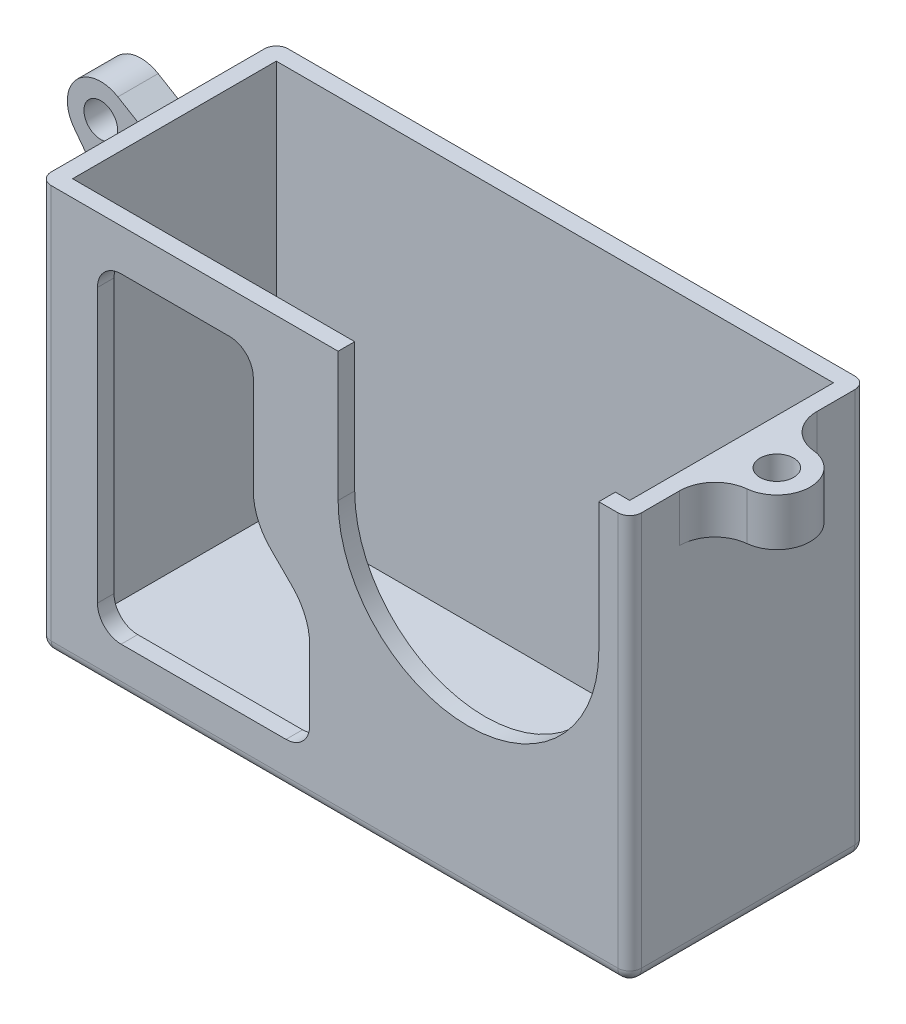
from build123d import *

# Parameters (mm, degrees)
SKETCH3_W               = 1.778
SKETCH3_H               = 21.844
SKETCH4_W               = 63.2968
SKETCH4_H               = 43.561
BOSS_EXTRUDE1_DEPTH     = 1.778
BOSS_EXTRUDE2_DEPTH     = 1.778
SKETCH6_R               = 1.8034
BOSS_EXTRUDE3_DEPTH     = 5.08
FILLET2_R               = 3.81
SKETCH7_R               = 1.8034
BOSS_EXTRUDE4_DEPTH     = 25.4
CUT_EXTRUDE1_DEPTH      = 82.893164904
CUT_EXTRUDE1_DEPTH_BACK = 82.893164904
SKETCH8_W               = 7.5438
SKETCH8_H               = 10.541
SKETCH13_R              = 2.52476
BOSS_EXTRUDE5_DEPTH     = 63.2968
SKETCH14_W              = 27.40279
SKETCH14_H              = 7.62
SKETCH14_H_2            = 8.382
SKETCH14_W_2            = 3.45694
CUT_EXTRUDE2_DEPTH      = 80.858589657
FILLET3_R               = 8.382
FILLET4_R               = 1.27


# Some blends are built 0.0001 mm under size
with BuildPart() as part:
    # Sweep1: sweep along a path in Sketch1
    with BuildLine(Plane.XY) as sweep1_path:
        Line((0, 41.783), (0, 0))
        Line((0, 0), (59.7408, 0))
        Line((59.7408, 0), (59.7408, 41.783))
    # Sketch3 → Sweep1 (sweep)
    with BuildSketch(Plane(origin=(0, 41.783, 0), x_dir=(1, 0, 0), z_dir=(0, 1, 0))):
        with Locations((-0.889, 0)):
            Rectangle(SKETCH3_W, SKETCH3_H)
    sweep(path=sweep1_path.line, transition=Transition.RIGHT)

    # Sketch4 → Boss-Extrude1 (add)
    with BuildSketch(Plane(origin=(0, 0, -10.922), x_dir=(-1, 0, 0), z_dir=(0, 0, -1))):
        with Locations((-29.8704, 20.0025)):
            Rectangle(SKETCH4_W, SKETCH4_H)
    extrude(amount=BOSS_EXTRUDE1_DEPTH)

    # Sketch5 → Boss-Extrude2 (add)
    # profile 1 of 2: a face of its own
    with BuildSketch(Plane.XY.offset(10.922)):
        with BuildLine():
            Line((30.2514, 41.783), (0, 41.783))
            Line((0, 41.783), (0, 0))
            Line((0, 0), (59.7408, 0))
            Line((59.7408, 0), (59.7408, 41.783))
            Line((59.7408, 41.783), (58.20156, 41.783))
            Line((58.20156, 41.783), (58.20156, 27.91968))
            ThreePointArc((58.20156, 27.91968), (44.22648, 13.9446), (30.2514, 27.91968))
            Line((30.2514, 27.91968), (30.2514, 41.783))
        make_face()
        with BuildLine():
            Line((4.445, 5.4864), (4.445, 34.798))
            ThreePointArc((4.445, 34.798), (5.188948776, 36.594051224), (6.985, 37.338))
            Line((6.985, 37.338), (18.6182, 37.338))
            ThreePointArc((18.6182, 37.338), (20.414251224, 36.594051224), (21.1582, 34.798))
            Line((21.1582, 34.798), (21.1582, 24.296354404))
            ThreePointArc((21.1582, 24.296354404), (21.641564969, 21.866314608), (23.018071939, 19.806226343))
            Line((23.018071939, 19.806226343), (25.343528061, 17.480770222))
            ThreePointArc((25.343528061, 17.480770222), (26.720035031, 15.420681957), (27.2034, 12.990642162))
            Line((27.2034, 12.990642162), (27.2034, 5.4864))
            ThreePointArc((27.2034, 5.4864), (26.459451224, 3.690348776), (24.6634, 2.9464))
            Line((24.6634, 2.9464), (6.985, 2.9464))
            ThreePointArc((6.985, 2.9464), (5.188948776, 3.690348776), (4.445, 5.4864))
        make_face(mode=Mode.SUBTRACT)
    # profile 2 of 2: a face of its own
    with BuildSketch(Plane.XY.offset(10.922)):
        Polygon((61.5188, 41.783), (59.7408, 41.783), (59.7408, 0), (0, 0), (0, 41.783), (-1.778, 41.783), (-1.778, -1.778), (61.5188, -1.778), align=None)
    extrude(amount=BOSS_EXTRUDE2_DEPTH)

    # Sketch6 → Boss-Extrude3 (add)
    with BuildSketch(Plane(origin=(0, 41.783, 0), x_dir=(1, 0, 0), z_dir=(0, 1, 0))):
        with BuildLine():
            Line((64.5922, 3.5814), (61.5188, 3.5814))
            Line((61.5188, 3.5814), (61.5188, -3.5814))
            Line((61.5188, -3.5814), (64.5922, -3.5814))
            ThreePointArc((64.5922, -3.5814), (68.1736, 0), (64.5922, 3.5814))
        make_face()
        with Locations(Location((64.5922, 0, 0), (0, 0, 180))):
            Circle(SKETCH6_R, mode=Mode.SUBTRACT)
    extrude(amount=-BOSS_EXTRUDE3_DEPTH)

    # Fillet2
    # the kernel refuses this fillet: 3.81 mm, written as the material it adds along each edge
    with BuildSketch(Plane(origin=(61.5188, 41.783, -3.5814), x_dir=(0, 0, -1), z_dir=(0, -1, 0))) as fillet2_piece_1:
        with BuildLine():
            CenterArc((3.773204979, 3.81), FILLET2_R, 185.719382358, 84.280617642)
            Line((-0.017828515, 3.430309278), (-0.396931865, 3.392340206))
            ThreePointArc((-0.396931865, 3.392340206), (-0.381, 3.0734), (-0.381, 0))
            Line((-0.381, 0), (0, -0.381))
            Line((0, -0.381), (3.773204979, -0.381))
            Line((3.773204979, -0.381), (3.773204979, 0))
        make_face()
    extrude(amount=5.08)
    with BuildSketch(Plane(origin=(61.5188, 41.783, 3.5814), x_dir=(0, 0, 1), z_dir=(0, -1, 0))) as fillet2_piece_2:
        with BuildLine():
            CenterArc((3.773204979, -3.81), FILLET2_R, 90, 84.280617642)
            Line((-0.017828515, -3.430309278), (-0.396931865, -3.392340206))
            ThreePointArc((-0.396931865, -3.392340206), (-0.381, -3.0734), (-0.381, 0))
            Line((-0.381, 0), (0, 0.381))
            Line((0, 0.381), (3.773204979, 0.381))
            Line((3.773204979, 0.381), (3.773204979, 0))
        make_face()
    extrude(amount=5.08)

    # Sketch7 → Boss-Extrude4 (add)
    with BuildSketch(Plane.XY.offset(12.7)):
        with BuildLine():
            Line((-1.778, 36.3982), (-1.778, 41.783))
            Line((-1.778, 41.783), (-3.902308892, 43.053335031))
            ThreePointArc((-3.902308892, 43.053335031), (-8.404920605, 42.372664125), (-8.599730754, 37.82306259))
            Line((-8.599730754, 37.82306259), (-1.778, 28.7782))
            Line((-1.778, 28.7782), (-1.778, 36.3982))
        make_face()
        with Locations((-5.7404, 39.9796)):
            Circle(SKETCH7_R, mode=Mode.SUBTRACT)
    extrude(amount=-BOSS_EXTRUDE4_DEPTH)

    # Sketch8 → Cut-Extrude1 (cut, two sides: drawn at the far end of the back side and taken through both)
    with BuildSketch(Plane(origin=(0, 41.783, 0), x_dir=(1, 0, 0), z_dir=(0, 1, 0)).offset(-CUT_EXTRUDE1_DEPTH_BACK)):
        with Locations((-5.5499, 7.4295)):
            Rectangle(SKETCH8_W, SKETCH8_H)
        with Locations((-5.5499, -7.4295)):
            Rectangle(SKETCH8_W, SKETCH8_H)
    extrude(amount=CUT_EXTRUDE1_DEPTH + CUT_EXTRUDE1_DEPTH_BACK, mode=Mode.SUBTRACT)

    # Sketch13 → Boss-Extrude5 (add)
    with BuildSketch(Plane.ZY.offset(1.778)):
        with BuildLine():
            Line((-21.082, -1.778), (-12.7, -1.778))
            Line((-12.7, -1.778), (-12.7, 13.462))
            Line((-12.7, 13.462), (-21.082, 13.462))
            ThreePointArc((-21.082, 13.462), (-28.702, 5.842), (-21.082, -1.778))
        make_face()
        with Locations((-21.082, 5.842)):
            Circle(SKETCH13_R, mode=Mode.SUBTRACT)
    extrude(amount=-BOSS_EXTRUDE5_DEPTH)

    # Sketch14 → Cut-Extrude2 (cut, through all)
    with BuildSketch(Plane(origin=(0, 13.462, 0), x_dir=(1, 0, 0), z_dir=(0, 1, 0))):
        with Locations((11.923395, 24.892)):
            Rectangle(SKETCH14_W, SKETCH14_H)
        with Locations((11.923395, 16.891)):
            Rectangle(SKETCH14_W, SKETCH14_H_2)
        with Locations((47.817405, 16.891)):
            Rectangle(SKETCH14_W, SKETCH14_H_2)
        with Locations((47.817405, 24.892)):
            Rectangle(SKETCH14_W, SKETCH14_H)
        with Locations((29.8704, 24.892)):
            Rectangle(SKETCH14_W_2, SKETCH14_H)
        with Locations((29.8704, 16.891)):
            Rectangle(SKETCH14_W_2, SKETCH14_H_2)
    extrude(amount=-CUT_EXTRUDE2_DEPTH, mode=Mode.SUBTRACT)

    # Fillet3
    fillet3_edges = [part.edges().sort_by_distance(p)[0] for p in [
        (26.88336, 13.462, -12.7),
        (32.85744, 13.462, -12.7),
    ]]
    fillet(fillet3_edges, radius=FILLET3_R - 0.0001)  # a hair under: the kernel refuses the full size

    # Fillet4
    fillet4_edges = [part.edges().sort_by_distance(p)[0] for p in [
        (61.5188, -1.778, 0),
        (-1.778, 20.0025, 12.7),
        (-1.778, -1.778, 0),
        (-1.778, 20.0025, -12.7),
        (11.923395, -1.778, -12.7),
        (47.817405, -1.778, -12.7),
        (29.8704, -1.778, -12.7),
        (61.5188, 20.0025, -12.7),
        (29.8704, -1.778, 12.7),
        (61.5188, 20.0025, 12.7),
    ]]
    fillet(fillet4_edges, radius=FILLET4_R)


solid = part.part
